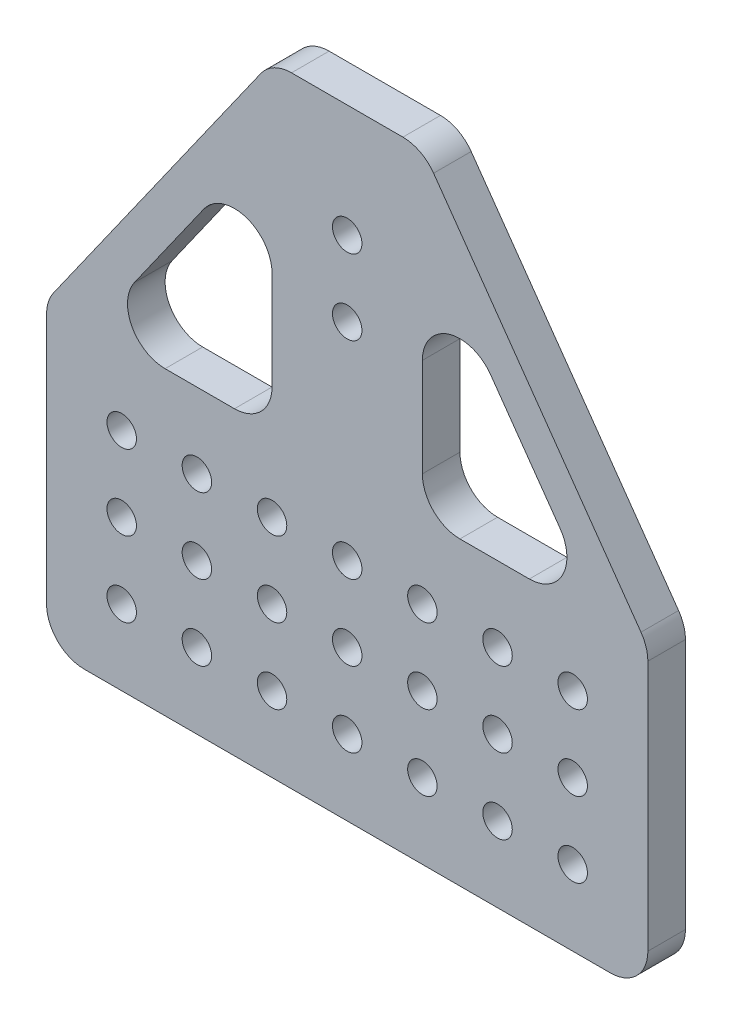
from build123d import *

# Parameters (mm, degrees)
SKETCH1_R           = 2.4892
BOSS_EXTRUDE1_DEPTH = 3.175
LPATTERN1_START     = -3.175
LPATTERN1_OUTLINE_R = 2.4892
LPATTERN1_DEPTH     = 6.35
SKETCH2_R           = 2.4892
CUT_EXTRUDE1_DEPTH  = 123.679962198
FILLET1_R           = 6.35


# Read off the part's stored shape, not the designer's step: LPattern1
with BuildPart() as part:
    # Sketch1 → Boss-Extrude1 (new, symmetric)
    with BuildSketch(Plane.XY):
        Polygon((0, 104.775), (25.4, 104.775), (63.5, 50.8), (63.5, 0), (0, 0), (-38.1, 0), (-38.1, 50.8), align=None)
        with Locations((12.7, 85.725)):
            Circle(SKETCH1_R, mode=Mode.SUBTRACT)
        with Locations((12.7, 73.025)):
            Circle(SKETCH1_R, mode=Mode.SUBTRACT)
        with Locations((12.7, 12.7)):
            Circle(SKETCH1_R, mode=Mode.SUBTRACT)
    extrude(amount=BOSS_EXTRUDE1_DEPTH, both=True)

    # LPattern1 outline → LPattern1 (cut)
    with BuildSketch(Plane.XY.offset(LPATTERN1_START)):
        with Locations((50.8, 38.1)):
            Circle(LPATTERN1_OUTLINE_R)
        with Locations((38.1, 38.1)):
            Circle(LPATTERN1_OUTLINE_R)
        with Locations((25.4, 38.1)):
            Circle(LPATTERN1_OUTLINE_R)
        with Locations((12.7, 38.1)):
            Circle(LPATTERN1_OUTLINE_R)
        with Locations((50.8, 25.4)):
            Circle(LPATTERN1_OUTLINE_R)
        with Locations((38.1, 25.4)):
            Circle(LPATTERN1_OUTLINE_R)
        with Locations((25.4, 25.4)):
            Circle(LPATTERN1_OUTLINE_R)
        with Locations((12.7, 25.4)):
            Circle(LPATTERN1_OUTLINE_R)
        with Locations((50.8, 12.7)):
            Circle(LPATTERN1_OUTLINE_R)
        with Locations((38.1, 12.7)):
            Circle(LPATTERN1_OUTLINE_R)
        with Locations((25.4, 12.7)):
            Circle(LPATTERN1_OUTLINE_R)
    extrude(amount=LPATTERN1_DEPTH, mode=Mode.SUBTRACT)

    # Sketch2 → Cut-Extrude1 (cut, through all)
    with BuildSketch(Plane.XY.offset(3.175)):
        with Locations((12.7, 38.1)):
            Circle(SKETCH2_R)
        with Locations((12.7, 25.4)):
            Circle(SKETCH2_R)
        with Locations((12.7, 12.7)):
            Circle(SKETCH2_R)
        with Locations((0, 12.7)):
            Circle(SKETCH2_R)
        with Locations((0, 25.4)):
            Circle(SKETCH2_R)
        with Locations((0, 38.1)):
            Circle(SKETCH2_R)
        with Locations((-12.7, 12.7)):
            Circle(SKETCH2_R)
        with Locations((-12.7, 25.4)):
            Circle(SKETCH2_R)
        with Locations((-12.7, 38.1)):
            Circle(SKETCH2_R)
        with Locations((-25.4, 12.7)):
            Circle(SKETCH2_R)
        with Locations((-25.4, 25.4)):
            Circle(SKETCH2_R)
        with Locations((-25.4, 38.1)):
            Circle(SKETCH2_R)
        Polygon((25.4, 50.8), (25.4, 93.763754959), (55.727356441, 50.8), align=None)
        Polygon((0, 50.8), (-30.327356441, 50.8), (0, 93.763754959), align=None)
    extrude(amount=-CUT_EXTRUDE1_DEPTH, mode=Mode.SUBTRACT)

    # Fillet1
    fillet1_edges = [part.edges().sort_by_distance(p)[0] for p in [
        (-38.1, 0, 0),
        (-38.1, 50.8, 0),
        (0, 104.775, 0),
        (25.4, 104.775, 0),
        (63.5, 50.8, 0),
        (63.5, 0, 0),
        (55.727356441, 50.8, 0),
        (25.4, 50.8, 0),
        (25.4, 93.763754959, 0),
        (0, 93.763754959, 0),
        (0, 50.8, 0),
        (-30.327356441, 50.8, 0),
    ]]
    fillet(fillet1_edges, radius=FILLET1_R)


solid = part.part
